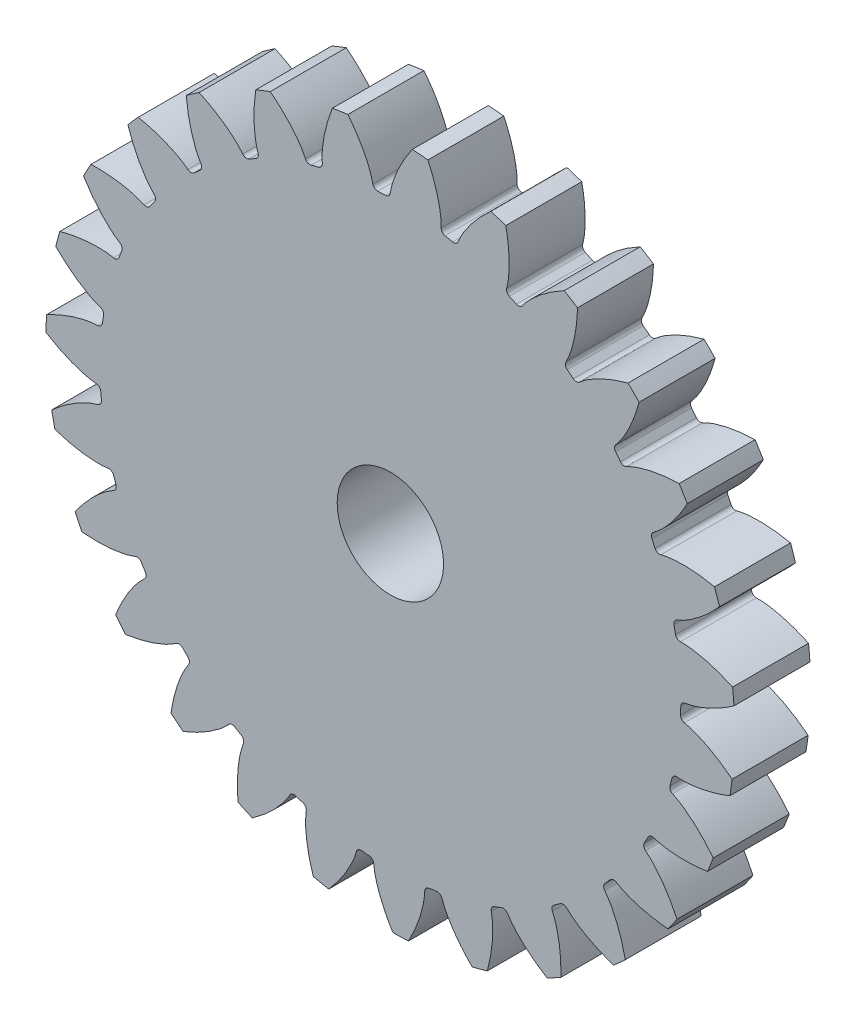
from build123d import *

# Parameters (mm, degrees)
SKETCH2_R                = 18.125
BOSS_EXTRUDE1_DEPTH      = 4
CUT_EXTRUDE1_DEPTH       = 4
FILLET1_R                = 0.254
CIRPATTERN3_COUNT        = 27
FILLET1_OF_CIRPATTERN3_R = 0.254
SKETCH3_R                = 2.8
CUT_EXTRUDE2_DEPTH       = 26.94232283


# Read off the part's stored shape, not the designer's step: Cut-Extrude1
with BuildPart() as part:
    # Sketch2 → Boss-Extrude1 (new body)
    with BuildSketch(Plane.XY):
        Circle(SKETCH2_R)
    extrude(amount=BOSS_EXTRUDE1_DEPTH)

    # Cut-Extrude1 outline → Cut-Extrude1 (cut)
    with BuildSketch(Plane.XY):
        with BuildLine():
            add(Edge.make_bspline(
                [(15.293943906, 0), (15.305253299, 0), (15.336964339, 0.00074082), (15.396845119, 0.005066139), (15.494240284, 0.016267993), (15.617714722, 0.036610689), (15.776289364, 0.069834677), (15.961506744, 0.117828662), (16.163035486, 0.179773153), (16.379749283, 0.256988095), (16.59342961, 0.342624014), (16.803983292, 0.435958219), (17.011216032, 0.536009953), (17.259008351, 0.665439426), (17.551466226, 0.832023435), (17.793413557, 0.984652677), (17.98203981, 1.112094263), (18.081230118, 1.181579697), (18.086216109, 1.185078834)],
                knots=[0, 0, 0, 0, 0, 0.005376748, 0.015083688, 0.02853182, 0.046610139, 0.064854849, 0.092110525, 0.119476175, 0.146842495, 0.174208853, 0.201574955, 0.228941013, 0.256307345, 0.307035032, 0.361767351, 0.364665932, 0.364665932, 0.364665932, 0.364665932, 0.364665932], degree=4))
            Line((15.293943906, 0), (15.269621682, -0.86219134))
            add(Edge.make_bspline(
                [(17.990644834, -2.202799001), (17.985864036, -2.199024345), (17.890748691, -2.124057592), (17.709606894, -1.986184932), (17.476648761, -1.820158714), (17.194047109, -1.637352405), (16.953945405, -1.49415955), (16.752682616, -1.382584249), (16.547725468, -1.277528577), (16.339212659, -1.179982683), (16.127196474, -1.090673365), (15.929480328, -1.017466265), (15.747263149, -0.959107033), (15.590813683, -0.916996286), (15.468682422, -0.889725108), (15.372073647, -0.873050446), (15.312531935, -0.865356246), (15.280913089, -0.862828904), (15.269621682, -0.86219134)],
                knots=[0.544424984, 0.544424984, 0.544424984, 0.544424984, 0.544424984, 0.547323565, 0.602055884, 0.652783571, 0.680149903, 0.707515961, 0.734882063, 0.762248421, 0.789614741, 0.816980391, 0.844236067, 0.862480777, 0.880559096, 0.894007228, 0.903714168, 0.909090916, 0.909090916, 0.909090916, 0.909090916, 0.909090916], degree=4))
            ThreePointArc((17.990644834, -2.202799001), (18.117792441, -0.511098867), (18.086216109, 1.185078834))
        make_face()
    cut_extrude1 = extrude(amount=CUT_EXTRUDE1_DEPTH, mode=Mode.SUBTRACT)

    # Fillet1
    fillet1_edges = [part.edges().sort_by_distance(p)[0] for p in [
        (15.269621682, -0.86219134, 2),
        (15.293943906, 0, 2),
    ]]
    fillet(fillet1_edges, radius=FILLET1_R)

    # CirPattern3: Cut-Extrude1 ×27 about axis
    cirpattern3_axis = Axis((0, 0, 18.908609159), (0, 0, -1))
    for i in range(1, CIRPATTERN3_COUNT):
        add(cut_extrude1.rotate(cirpattern3_axis, i * 360 / CIRPATTERN3_COUNT), mode=Mode.SUBTRACT)

    # Fillet1 of CirPattern3
    fillet1_of_cirpattern3_edges = [part.edges().sort_by_distance(p)[0] for p in [
        (14.659192047, -4.360367961, 2),
        (14.881693669, -3.527026191, 2),
        (13.258481574, -7.623476016, 2),
        (13.667167474, -6.863909487, 2),
        (11.143002927, -10.475600507, 2),
        (11.715840743, -9.830757646, 2),
        (8.426802109, -12.762982662, 2),
        (9.132910004, -12.267627116, 2),
        (5.256310208, -14.362309119, 2),
        (6.057621724, -14.043145632, 2),
        (1.802449263, -15.187359773, 2),
        (2.655765489, -15.061594533, 2),
        (-1.748582189, -15.193655931, 2),
        (-0.889263752, -15.268068974, 2),
        (-5.205347122, -14.380858165, 2),
        (-4.386352553, -14.651437864, 2),
        (-8.381490444, -12.792784613, 2),
        (-7.646971953, -13.244943947, 2),
        (-11.105785447, -10.515048731, 2),
        (-10.495341116, -11.124411673, 2),
        (-13.231364682, -7.67044385, 2),
        (-12.777903722, -8.404159486, 2),
        (-14.643637622, -4.412323356, 2),
        (-14.371606231, -5.230836887, 2),
        (-15.266468268, -0.916333368, 2),
        (-15.190531729, -1.775518517, 2),
        (-15.066279658, 2.629056389, 2),
        (-15.190531729, 1.775518517, 2),
        (-14.053864011, 6.032713036, 2),
        (-14.371606231, 5.230836887, 2),
        (-12.283800918, 9.111144562, 2),
        (-12.777903722, 8.404159486, 2),
        (-9.851514938, 11.698391926, 2),
        (-10.495341116, 11.124411673, 2),
        (-6.888131238, 13.654975953, 2),
        (-7.646971953, 13.244943947, 2),
        (-3.553406599, 14.875416692, 2),
        (-4.386352553, 14.651437864, 2),
        (-0.027116892, 15.293919867, 2),
        (-0.889263752, 15.268068974, 2),
        (3.500634695, 14.887923863, 2),
        (2.655765489, 15.061594533, 2),
        (6.839666159, 13.67931603, 2),
        (6.057621724, 14.043145632, 2),
        (9.80996945, 11.733252729, 2),
        (9.132910004, 12.267627116, 2),
        (12.251414749, 9.154646737, 2),
        (11.715840743, 9.830757646, 2),
        (14.032383107, 6.082511369, 2),
        (13.667167474, 6.863909487, 2),
        (15.05686206, 2.682466239, 2),
        (14.881693669, 3.527026191, 2),
    ]]
    fillet(fillet1_of_cirpattern3_edges, radius=FILLET1_OF_CIRPATTERN3_R)

    # Sketch3 → Cut-Extrude2 (cut, through all)
    with BuildSketch(Plane(origin=(0, 0, 0), x_dir=(-1, 0, 0), z_dir=(0, 0, -1))):
        Circle(SKETCH3_R)
    extrude(amount=-CUT_EXTRUDE2_DEPTH, mode=Mode.SUBTRACT)


solid = part.part
